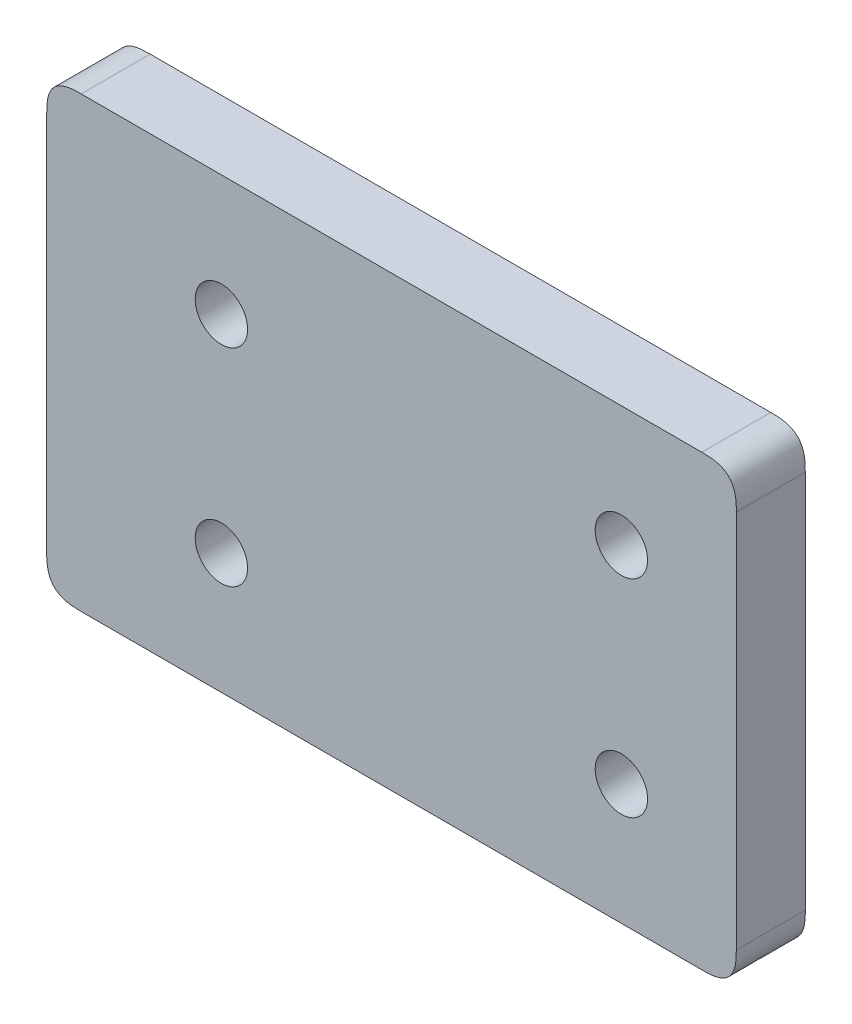
from build123d import *

# Parameters (mm, degrees)
SKETCH1_W               = 63.5
SKETCH1_H               = 41.275
BOSS_EXTRUDE1_DEPTH     = 6.35
CUT_EXTRUDE1_DEPTH      = 89.44526556
CUT_EXTRUDE1_DEPTH_BACK = 89.44526556
SKETCH3_R               = 2.413
FILLET1_SIZE            = 3.175


with BuildPart() as part:
    # Sketch1 → Boss-Extrude1 (new body)
    with BuildSketch(Plane.XY):
        with Locations((44.45, 23.8125)):
            Rectangle(SKETCH1_W, SKETCH1_H)
    extrude(amount=BOSS_EXTRUDE1_DEPTH)

    # Sketch3 → Cut-Extrude1 (cut, two sides: drawn at the far end of the back side and taken through both)
    with BuildSketch(Plane.XY.offset(6.35).offset(-CUT_EXTRUDE1_DEPTH_BACK)):
        with Locations((65.615475516, 33.3375)):
            Circle(SKETCH3_R)
        with Locations((28.785475516, 33.3375)):
            Circle(SKETCH3_R)
        with Locations((28.785475516, 14.2875)):
            Circle(SKETCH3_R)
        with Locations((65.615475516, 14.2875)):
            Circle(SKETCH3_R)
    extrude(amount=CUT_EXTRUDE1_DEPTH + CUT_EXTRUDE1_DEPTH_BACK, mode=Mode.SUBTRACT)

    # Fillet1
    # a fillet whose section is not a circle: 3.175 mm, written as the material it takes off along each edge
    with BuildSketch(Plane(origin=(12.7, 3.175, -7.9375), x_dir=(1, 0, 0), z_dir=(0, 0, 1)), Plane(origin=(12.7, 44.45, -7.9375), x_dir=(0, -1, 0), z_dir=(0, 0, 1))) as fillet1_piece_1:
        with BuildLine():
            add(Edge.make_bspline([(FILLET1_SIZE, 0), (FILLET1_SIZE * 0.831801948466, 0), (FILLET1_SIZE * 0.663603896932, 0), (FILLET1_SIZE * 0.292893218813, FILLET1_SIZE * 0.0716919198361), (FILLET1_SIZE * 0.0716919198361, FILLET1_SIZE * 0.292893218813), (0, FILLET1_SIZE * 0.663603896932), (0, FILLET1_SIZE * 0.831801948466), (0, FILLET1_SIZE)], knots=[0, 0, 0, 0, 0, 0, 0.5, 0.5, 1, 1, 1, 1, 1, 1], degree=5))
            Line((0, FILLET1_SIZE), (0, 0))
            Line((0, 0), (FILLET1_SIZE, 0))
        make_face()
    extrude(amount=22.225, mode=Mode.SUBTRACT)
    with BuildSketch(Plane(origin=(76.2, 3.175, -7.9375), x_dir=(-1, 0, 0), z_dir=(0, 0, 1)), Plane(origin=(76.2, 44.45, -7.9375), x_dir=(0, -1, 0), z_dir=(0, 0, 1))) as fillet1_piece_2:
        with BuildLine():
            add(Edge.make_bspline([(FILLET1_SIZE, 0), (FILLET1_SIZE * 0.831801948466, 0), (FILLET1_SIZE * 0.663603896932, 0), (FILLET1_SIZE * 0.292893218813, -FILLET1_SIZE * 0.0716919198361), (FILLET1_SIZE * 0.0716919198361, -FILLET1_SIZE * 0.292893218813), (0, -FILLET1_SIZE * 0.663603896932), (0, -FILLET1_SIZE * 0.831801948466), (0, -FILLET1_SIZE)], knots=[0, 0, 0, 0, 0, 0, 0.5, 0.5, 1, 1, 1, 1, 1, 1], degree=5))
            Line((0, -FILLET1_SIZE), (0, 0))
            Line((0, 0), (FILLET1_SIZE, 0))
        make_face()
    extrude(amount=22.225, mode=Mode.SUBTRACT)


solid = part.part
